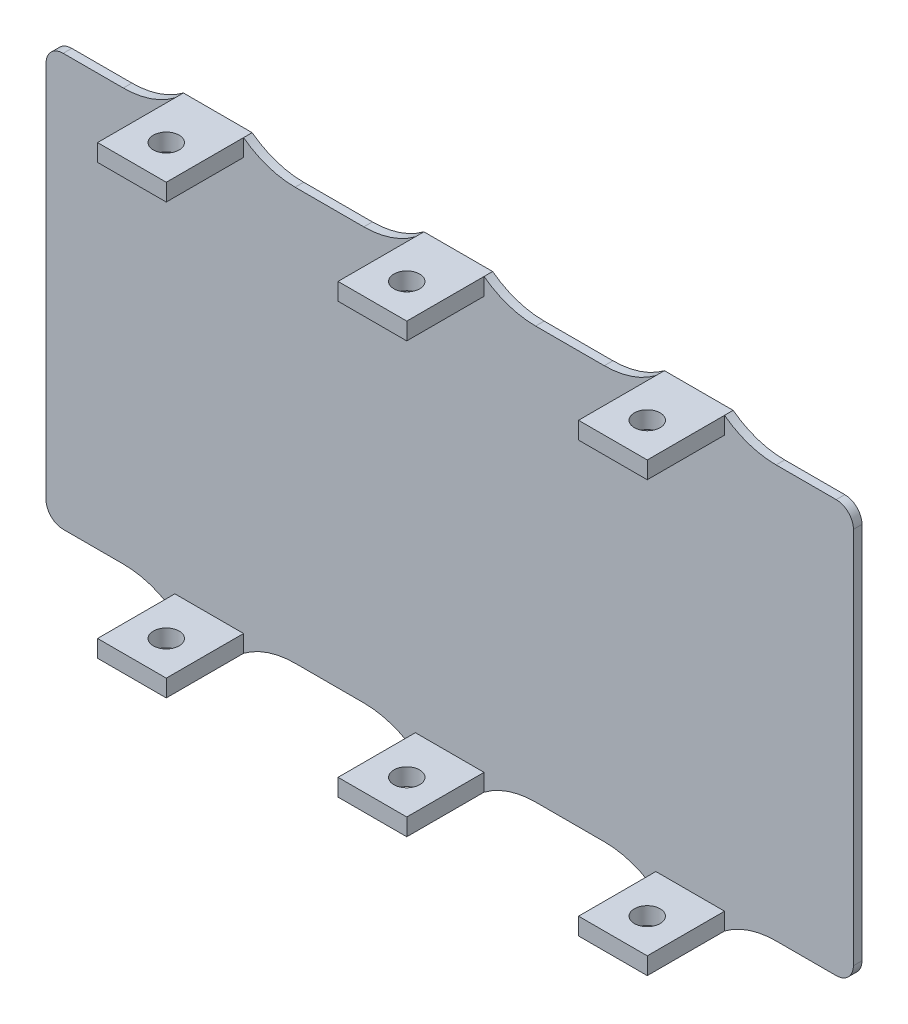
from build123d import *

# Parameters (mm, degrees)
SKETCH_1_W          = 94
SKETCH_1_H          = 48
EXTRUDE_1_DEPTH     = 1
SKETCH_2_W          = 8
SKETCH_2_H          = 10
EXTRUDE_2_DEPTH     = 2
FILLET_1_R          = 10
SKETCH_3_R          = 1.5
CUT_EXTRUDE_1_DEPTH = 71.802542327
FILLET_2_R          = 2


with BuildPart() as part:
    # Эскиз1 → Бобышка-Вытянуть1 (new body)
    with BuildSketch(Plane.XY):
        Rectangle(SKETCH_1_W, SKETCH_1_H)
    extrude(amount=EXTRUDE_1_DEPTH)

    # Эскиз2 → Бобышка-Вытянуть2 (add)
    with BuildSketch(Plane.XZ.offset(24)):
        with Locations((-28, 5)):
            Rectangle(SKETCH_2_W, SKETCH_2_H)
        with Locations((28, 5)):
            Rectangle(SKETCH_2_W, SKETCH_2_H)
        with Locations((0, 5)):
            Rectangle(SKETCH_2_W, SKETCH_2_H)
    extrude_2 = extrude(amount=EXTRUDE_2_DEPTH)

    # Зеркальное отражение1: Бобышка-Вытянуть2 across plane
    add(extrude_2.mirror(Plane.ZX))

    # Скругление1
    # the kernel refuses this fillet: 10 mm, written as the material it adds along each edge
    with BuildSketch(Plane(origin=(-32, 24, 1), x_dir=(-1, 0, 0), z_dir=(0, 0, -1)), Plane(origin=(-24, 24, 0), x_dir=(1, 0, 0), z_dir=(0, 0, 1)), Plane(origin=(-4, 24, 1), x_dir=(-1, 0, 0), z_dir=(0, 0, -1)), Plane(origin=(4, 24, 0), x_dir=(1, 0, 0), z_dir=(0, 0, 1)), Plane(origin=(24, 24, 1), x_dir=(-1, 0, 0), z_dir=(0, 0, -1)), Plane(origin=(32, 24, 0), x_dir=(1, 0, 0), z_dir=(0, 0, 1))) as fillet_1_piece_1:
        with BuildLine():
            CenterArc((6, 10), FILLET_1_R, 233.130102354, 36.869897646)
            Line((0, 2), (0, 0))
            Line((0, 0), (6, 0))
        make_face()
    extrude(amount=1)
    with BuildSketch(Plane(origin=(32, -24, 0), x_dir=(0, -1, 0), z_dir=(0, 0, 1)), Plane(origin=(4, -24, 0), x_dir=(0, -1, 0), z_dir=(0, 0, 1)), Plane(origin=(-24, -24, 0), x_dir=(0, -1, 0), z_dir=(0, 0, 1))) as fillet_1_piece_2:
        with BuildLine():
            CenterArc((10, 6), FILLET_1_R, 180, 36.869897646)
            Line((0, 6), (0, 0))
            Line((0, 0), (2, 0))
        make_face()
    extrude(amount=1)
    with BuildSketch(Plane(origin=(24, -24, 1), x_dir=(-1, 0, 0), z_dir=(0, 0, -1)), Plane(origin=(-4, -24, 1), x_dir=(-1, 0, 0), z_dir=(0, 0, -1)), Plane(origin=(-32, -24, 1), x_dir=(-1, 0, 0), z_dir=(0, 0, -1))) as fillet_1_piece_3:
        with BuildLine():
            CenterArc((6, -10), FILLET_1_R, 90, 36.869897646)
            Line((0, -2), (0, 0))
            Line((0, 0), (6, 0))
        make_face()
    extrude(amount=1)

    # Эскиз3 → Вырез-Вытянуть1 (cut, through all)
    with BuildSketch(Plane.XZ.offset(26)):
        with Locations(Location((-28, 6, 0), (0, 0, 270))):
            Circle(SKETCH_3_R)
        with Locations(Location((0, 6, 0), (0, 0, 270))):
            Circle(SKETCH_3_R)
        with Locations(Location((28, 6, 0), (0, 0, 270))):
            Circle(SKETCH_3_R)
    extrude(amount=-CUT_EXTRUDE_1_DEPTH, mode=Mode.SUBTRACT)

    # Скругление2
    fillet_2_edges = [part.edges().sort_by_distance(p)[0] for p in [
        (47, -24, 0.5),
        (-47, -24, 0.5),
        (-47, 24, 0.5),
        (47, 24, 0.5),
    ]]
    fillet(fillet_2_edges, radius=FILLET_2_R)


solid = part.part
